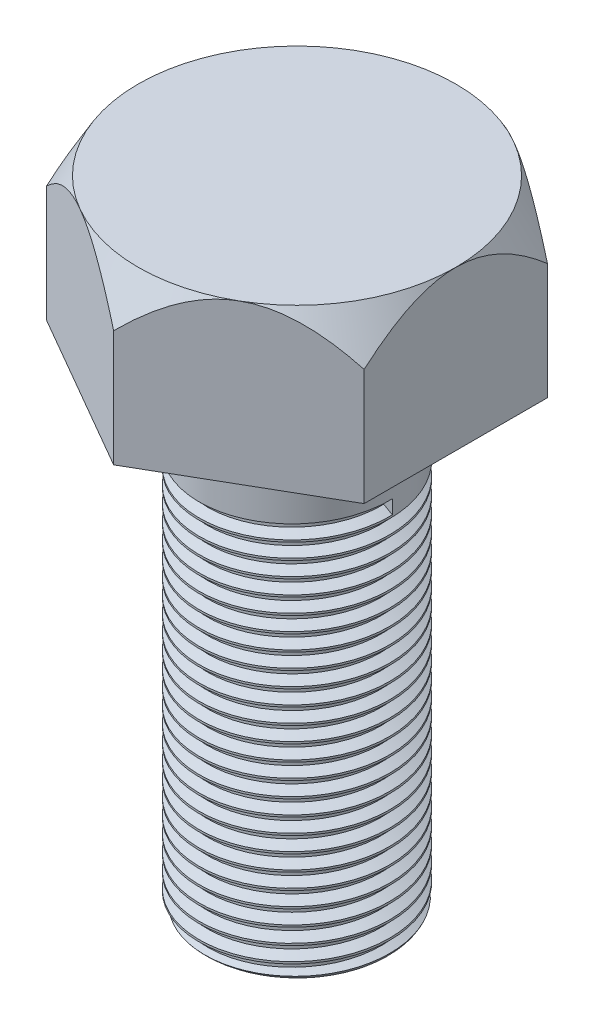
from build123d import *

# Parameters (mm, degrees)
BOSS_EXTRUDE1_DEPTH = 20
SKETCH2_OUTSIDE_W   = 98.176
SKETCH2_OUTSIDE_H   = 104.364
SKETCH2_OUTSIDE_R   = 20
CUT_EXTRUDE3_DEPTH  = 37.514837167
CUT_EXTRUDE3_DRAFT  = -30
SKETCH5_R           = 12
BOSS_EXTRUDE4_DEPTH = 60
FILLET1_R           = 2
THREAD1_PITCH       = 2


with BuildPart() as part:
    # Sketch1 → Boss-Extrude1 (new body)
    with BuildSketch(Plane(origin=(0, 0, 0), x_dir=(1, 0, 0), z_dir=(0, 1, 0))):
        Polygon((0, 23.094010768), (-20, 11.547005384), (-20, -11.547005384), (0, -23.094010768), (20, -11.547005384), (20, 11.547005384), align=None)
    extrude(amount=BOSS_EXTRUDE1_DEPTH)


with BuildPart() as cut_extrude3_tool:
    # Sketch2 outside → Cut-Extrude3 (with draft: the straight prism first)
    with BuildSketch(Plane(origin=(0, 20, 0), x_dir=(1, 0, 0), z_dir=(0, 1, 0))):
        Rectangle(SKETCH2_OUTSIDE_W, SKETCH2_OUTSIDE_H)
        Circle(SKETCH2_OUTSIDE_R, mode=Mode.SUBTRACT)
    extrude(amount=-CUT_EXTRUDE3_DEPTH)
    # Cut-Extrude3: the draft: its side faces are tilted about the plane it starts from
    cut_extrude3_sides = [cut_extrude3_tool.faces().sort_by_distance(p)[0] for p in [
        (0, 1.242581416, 52.182),
        (49.088, 1.242581416, 0),
        (0, 1.242581416, -52.182),
        (-49.088, 1.242581416, 0),
        (-20, 1.242581416, 0),
    ]]
    draft(cut_extrude3_sides, Plane(origin=(0, 20, 0), x_dir=(1, 0, 0), z_dir=(0, 1, 0)), CUT_EXTRUDE3_DRAFT)


with BuildPart() as part_1:
    add(part.part)

    # Cut-Extrude3: cut by cut_extrude3_tool
    add(cut_extrude3_tool.part, mode=Mode.SUBTRACT)

    # Sketch5 → Boss-Extrude4 (add)
    with BuildSketch(Plane.XZ):
        with Locations(Location((0, 0, 0), (0, 0, 270))):
            Circle(SKETCH5_R)
    extrude(amount=BOSS_EXTRUDE4_DEPTH)

    # Fillet1
    fillet1_edges = [part_1.edges().sort_by_distance(p)[0] for p in [
        (0, -60, 12),
    ]]
    fillet(fillet1_edges, radius=FILLET1_R)

    # Thread1: arcs per turn and ends read off the stored shape
    # Thread1: the profile of Thread Profile1 profile screwed along a right-hand helix through 25 turns, 10 arcs to a turn; built about Z, then put on its axis
    thread1_z = Axis((0, 0, 0), (0, 0, 1))
    thread1_corners = [(12.0003, 0, -0.000173205), (12.0003, 0, 1.7501732), (10.91746825, 0, 1.124999997), (10.91746825, 0, 0.624999997)]
    with BuildLine(mode=Mode.PRIVATE) as thread1_profile:
        Line(thread1_corners[0], thread1_corners[1])
        Line(thread1_corners[1], thread1_corners[2])
        Line(thread1_corners[2], thread1_corners[3])
        Line(thread1_corners[3], thread1_corners[0])
    thread1_cap = Face(thread1_profile.wire())
    thread1_turn_angles = [0, 18, 36, 54, 72, 90, 108, 126, 144, 162, 180, 198, 216, 234, 252, 270, 288, 306, 324, 342, 360]
    thread1_turn_weights = [1, 0.9510565162951535, 1, 0.9510565162951535, 1, 0.9510565162951535, 1, 0.9510565162951535, 1, 0.9510565162951535, 1, 0.9510565162951535, 1, 0.9510565162951535, 1, 0.9510565162951535, 1, 0.9510565162951535, 1, 0.9510565162951535, 1]
    thread1_turn_rails = [Edge.make_bspline([Vector(p[0], p[1], 0).rotate(thread1_z, thread1_turn_angles[k]) / thread1_turn_weights[k] + Vector(0, 0, p[2] + THREAD1_PITCH * thread1_turn_angles[k] / 360) for k in range(21)], [0, 0, 0, 1, 1, 2, 2, 3, 3, 4, 4, 5, 5, 6, 6, 7, 7, 8, 8, 9, 9, 10, 10, 10], 2, thread1_turn_weights) for p in thread1_corners]
    thread1_turn_sides = [Face.make_surface_from_curves(thread1_turn_rails[p[0]], thread1_turn_rails[p[1]]) for p in [(0, 1), (1, 2), (2, 3), (3, 0)]]
    thread1 = Plane(origin=(0, -61, 0), x_dir=(1, 0, 0), z_dir=(0, 1, 0)) * Solid(Shell([*[p.moved(Location((0, 0, THREAD1_PITCH * i))) for i in range(25) for p in thread1_turn_sides], thread1_cap, thread1_cap.rotate(thread1_z, 9000).moved(Location((0, 0, THREAD1_PITCH * 9000 / 360)))]))
    add(thread1, mode=Mode.SUBTRACT)


solid = part_1.part
